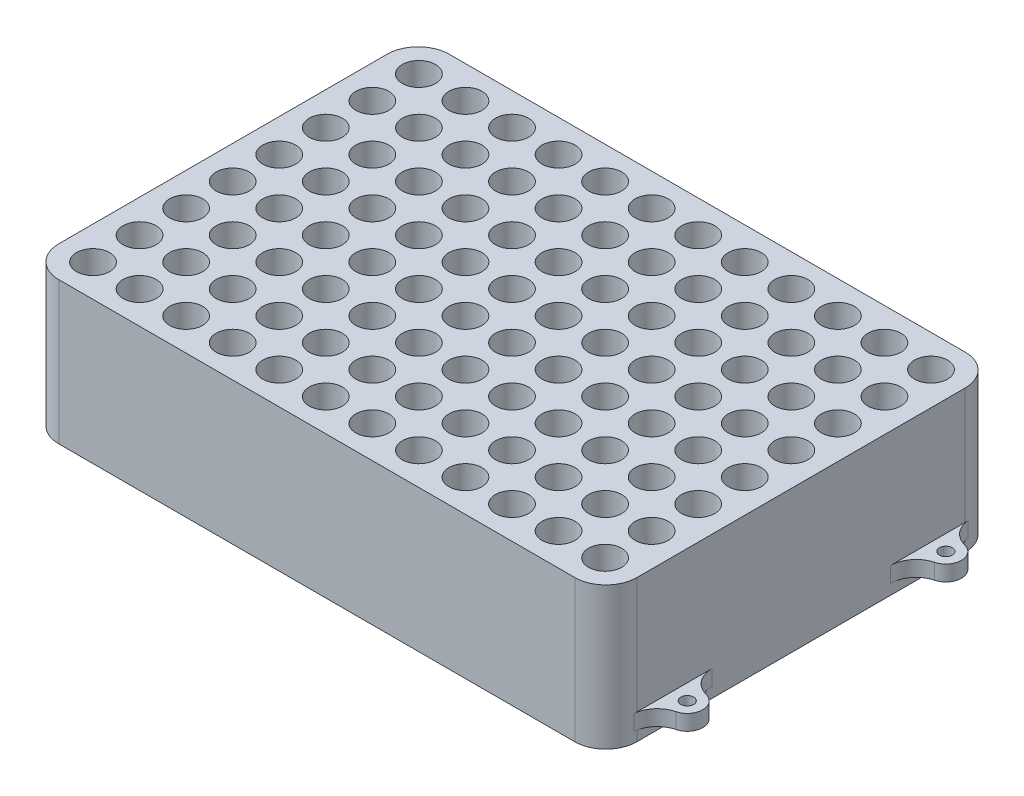
from build123d import *

# Parameters (mm, degrees)
BASE_STOCK_DEPTH        = 27.5
ESQUISSE2_R             = 3.2
VIALS_HOLES_DEPTH       = 80.026147572
ESQUISSE3_W             = 152.227357057
ESQUISSE3_H             = 97.588374714
ENL_V_MAT_EXTRU_2_DEPTH = 80.026147572
ENL_V_MAT_EXTRU_3_DEPTH = 20
BOSS_EXTRU_2_START      = 2
BOSS_EXTRU_2_DEPTH      = 3
CONG_1_R                = 5
TROU_TARAUD_M31_D       = 2.5


with BuildPart() as part:
    # Esquisse1 → Base Stock (new body)
    with BuildSketch(Plane(origin=(0, 0, 0), x_dir=(1, 0, 0), z_dir=(0, 1, 0))):
        with BuildLine():
            Line((-55.88, 40.74), (55.88, 40.74))
            ThreePointArc((55.88, 40.74), (60.122640687, 38.982640687), (61.88, 34.74))
            Line((61.88, 34.74), (61.88, -34.74))
            ThreePointArc((61.88, -34.74), (60.122640687, -38.982640687), (55.88, -40.74))
            Line((55.88, -40.74), (-55.88, -40.74))
            ThreePointArc((-55.88, -40.74), (-60.122640687, -38.982640687), (-61.88, -34.74))
            Line((-61.88, -34.74), (-61.88, 34.74))
            ThreePointArc((-61.88, 34.74), (-60.122640687, 38.982640687), (-55.88, 40.74))
        make_face()
    extrude(amount=BASE_STOCK_DEPTH)

    # Esquisse2 → Vials holes (cut, through all)
    with BuildSketch(Plane(origin=(0, 27.5, 0), x_dir=(1, 0, 0), z_dir=(0, 1, 0))):
        with Locations(Location((-49.5, 31.5, 0), (0, 0, 270))):
            Circle(ESQUISSE2_R)
        with Locations(Location((-40.5, 31.5, 0), (0, 0, 270))):
            Circle(ESQUISSE2_R)
        with Locations(Location((-31.5, 31.5, 0), (0, 0, 270))):
            Circle(ESQUISSE2_R)
        with Locations(Location((-22.5, 31.5, 0), (0, 0, 270))):
            Circle(ESQUISSE2_R)
        with Locations(Location((-13.5, 31.5, 0), (0, 0, 270))):
            Circle(ESQUISSE2_R)
        with Locations(Location((-4.5, 31.5, 0), (0, 0, 270))):
            Circle(ESQUISSE2_R)
        with Locations(Location((4.5, 31.5, 0), (0, 0, 270))):
            Circle(ESQUISSE2_R)
        with Locations(Location((13.5, 31.5, 0), (0, 0, 270))):
            Circle(ESQUISSE2_R)
        with Locations(Location((22.5, 31.5, 0), (0, 0, 270))):
            Circle(ESQUISSE2_R)
        with Locations(Location((31.5, 31.5, 0), (0, 0, 270))):
            Circle(ESQUISSE2_R)
        with Locations(Location((40.5, 31.5, 0), (0, 0, 270))):
            Circle(ESQUISSE2_R)
        with Locations(Location((49.5, 31.5, 0), (0, 0, 270))):
            Circle(ESQUISSE2_R)
        with Locations(Location((-40.5, 22.5, 0), (0, 0, 270))):
            Circle(ESQUISSE2_R)
        with Locations(Location((-31.5, 22.5, 0), (0, 0, 270))):
            Circle(ESQUISSE2_R)
        with Locations(Location((-22.5, 22.5, 0), (0, 0, 270))):
            Circle(ESQUISSE2_R)
        with Locations(Location((-13.5, 22.5, 0), (0, 0, 270))):
            Circle(ESQUISSE2_R)
        with Locations(Location((-4.5, 22.5, 0), (0, 0, 270))):
            Circle(ESQUISSE2_R)
        with Locations(Location((4.5, 22.5, 0), (0, 0, 270))):
            Circle(ESQUISSE2_R)
        with Locations(Location((13.5, 22.5, 0), (0, 0, 270))):
            Circle(ESQUISSE2_R)
        with Locations(Location((22.5, 22.5, 0), (0, 0, 270))):
            Circle(ESQUISSE2_R)
        with Locations(Location((31.5, 22.5, 0), (0, 0, 270))):
            Circle(ESQUISSE2_R)
        with Locations(Location((40.5, 22.5, 0), (0, 0, 270))):
            Circle(ESQUISSE2_R)
        with Locations(Location((49.5, 22.5, 0), (0, 0, 270))):
            Circle(ESQUISSE2_R)
        with Locations(Location((-40.5, 13.5, 0), (0, 0, 270))):
            Circle(ESQUISSE2_R)
        with Locations(Location((-31.5, 13.5, 0), (0, 0, 270))):
            Circle(ESQUISSE2_R)
        with Locations(Location((-22.5, 13.5, 0), (0, 0, 270))):
            Circle(ESQUISSE2_R)
        with Locations(Location((-13.5, 13.5, 0), (0, 0, 270))):
            Circle(ESQUISSE2_R)
        with Locations(Location((-4.5, 13.5, 0), (0, 0, 270))):
            Circle(ESQUISSE2_R)
        with Locations(Location((4.5, 13.5, 0), (0, 0, 270))):
            Circle(ESQUISSE2_R)
        with Locations(Location((13.5, 13.5, 0), (0, 0, 270))):
            Circle(ESQUISSE2_R)
        with Locations(Location((22.5, 13.5, 0), (0, 0, 270))):
            Circle(ESQUISSE2_R)
        with Locations(Location((31.5, 13.5, 0), (0, 0, 270))):
            Circle(ESQUISSE2_R)
        with Locations(Location((40.5, 13.5, 0), (0, 0, 270))):
            Circle(ESQUISSE2_R)
        with Locations(Location((49.5, 13.5, 0), (0, 0, 270))):
            Circle(ESQUISSE2_R)
        with Locations(Location((-40.5, 4.5, 0), (0, 0, 270))):
            Circle(ESQUISSE2_R)
        with Locations(Location((-31.5, 4.5, 0), (0, 0, 270))):
            Circle(ESQUISSE2_R)
        with Locations(Location((-22.5, 4.5, 0), (0, 0, 270))):
            Circle(ESQUISSE2_R)
        with Locations(Location((-13.5, 4.5, 0), (0, 0, 270))):
            Circle(ESQUISSE2_R)
        with Locations(Location((-4.5, 4.5, 0), (0, 0, 270))):
            Circle(ESQUISSE2_R)
        with Locations(Location((4.5, 4.5, 0), (0, 0, 270))):
            Circle(ESQUISSE2_R)
        with Locations(Location((13.5, 4.5, 0), (0, 0, 270))):
            Circle(ESQUISSE2_R)
        with Locations(Location((22.5, 4.5, 0), (0, 0, 270))):
            Circle(ESQUISSE2_R)
        with Locations(Location((31.5, 4.5, 0), (0, 0, 270))):
            Circle(ESQUISSE2_R)
        with Locations(Location((40.5, 4.5, 0), (0, 0, 270))):
            Circle(ESQUISSE2_R)
        with Locations(Location((49.5, 4.5, 0), (0, 0, 270))):
            Circle(ESQUISSE2_R)
        with Locations(Location((-40.5, -4.5, 0), (0, 0, 270))):
            Circle(ESQUISSE2_R)
        with Locations(Location((-31.5, -4.5, 0), (0, 0, 270))):
            Circle(ESQUISSE2_R)
        with Locations(Location((-22.5, -4.5, 0), (0, 0, 270))):
            Circle(ESQUISSE2_R)
        with Locations(Location((-13.5, -4.5, 0), (0, 0, 270))):
            Circle(ESQUISSE2_R)
        with Locations(Location((-4.5, -4.5, 0), (0, 0, 270))):
            Circle(ESQUISSE2_R)
        with Locations(Location((4.5, -4.5, 0), (0, 0, 270))):
            Circle(ESQUISSE2_R)
        with Locations(Location((13.5, -4.5, 0), (0, 0, 270))):
            Circle(ESQUISSE2_R)
        with Locations(Location((22.5, -4.5, 0), (0, 0, 270))):
            Circle(ESQUISSE2_R)
        with Locations(Location((31.5, -4.5, 0), (0, 0, 270))):
            Circle(ESQUISSE2_R)
        with Locations(Location((40.5, -4.5, 0), (0, 0, 270))):
            Circle(ESQUISSE2_R)
        with Locations(Location((49.5, -4.5, 0), (0, 0, 270))):
            Circle(ESQUISSE2_R)
        with Locations(Location((-40.5, -13.5, 0), (0, 0, 270))):
            Circle(ESQUISSE2_R)
        with Locations(Location((-31.5, -13.5, 0), (0, 0, 270))):
            Circle(ESQUISSE2_R)
        with Locations(Location((-22.5, -13.5, 0), (0, 0, 270))):
            Circle(ESQUISSE2_R)
        with Locations(Location((-13.5, -13.5, 0), (0, 0, 270))):
            Circle(ESQUISSE2_R)
        with Locations(Location((-4.5, -13.5, 0), (0, 0, 270))):
            Circle(ESQUISSE2_R)
        with Locations(Location((4.5, -13.5, 0), (0, 0, 270))):
            Circle(ESQUISSE2_R)
        with Locations(Location((13.5, -13.5, 0), (0, 0, 270))):
            Circle(ESQUISSE2_R)
        with Locations(Location((22.5, -13.5, 0), (0, 0, 270))):
            Circle(ESQUISSE2_R)
        with Locations(Location((31.5, -13.5, 0), (0, 0, 270))):
            Circle(ESQUISSE2_R)
        with Locations(Location((40.5, -13.5, 0), (0, 0, 270))):
            Circle(ESQUISSE2_R)
        with Locations(Location((49.5, -13.5, 0), (0, 0, 270))):
            Circle(ESQUISSE2_R)
        with Locations(Location((-40.5, -22.5, 0), (0, 0, 270))):
            Circle(ESQUISSE2_R)
        with Locations(Location((-31.5, -22.5, 0), (0, 0, 270))):
            Circle(ESQUISSE2_R)
        with Locations(Location((-22.5, -22.5, 0), (0, 0, 270))):
            Circle(ESQUISSE2_R)
        with Locations(Location((-13.5, -22.5, 0), (0, 0, 270))):
            Circle(ESQUISSE2_R)
        with Locations(Location((-4.5, -22.5, 0), (0, 0, 270))):
            Circle(ESQUISSE2_R)
        with Locations(Location((4.5, -22.5, 0), (0, 0, 270))):
            Circle(ESQUISSE2_R)
        with Locations(Location((13.5, -22.5, 0), (0, 0, 270))):
            Circle(ESQUISSE2_R)
        with Locations(Location((22.5, -22.5, 0), (0, 0, 270))):
            Circle(ESQUISSE2_R)
        with Locations(Location((31.5, -22.5, 0), (0, 0, 270))):
            Circle(ESQUISSE2_R)
        with Locations(Location((40.5, -22.5, 0), (0, 0, 270))):
            Circle(ESQUISSE2_R)
        with Locations(Location((49.5, -22.5, 0), (0, 0, 270))):
            Circle(ESQUISSE2_R)
        with Locations(Location((-40.5, -31.5, 0), (0, 0, 270))):
            Circle(ESQUISSE2_R)
        with Locations(Location((-31.5, -31.5, 0), (0, 0, 270))):
            Circle(ESQUISSE2_R)
        with Locations(Location((-22.5, -31.5, 0), (0, 0, 270))):
            Circle(ESQUISSE2_R)
        with Locations(Location((-13.5, -31.5, 0), (0, 0, 270))):
            Circle(ESQUISSE2_R)
        with Locations(Location((-4.5, -31.5, 0), (0, 0, 270))):
            Circle(ESQUISSE2_R)
        with Locations(Location((4.5, -31.5, 0), (0, 0, 270))):
            Circle(ESQUISSE2_R)
        with Locations(Location((13.5, -31.5, 0), (0, 0, 270))):
            Circle(ESQUISSE2_R)
        with Locations(Location((22.5, -31.5, 0), (0, 0, 270))):
            Circle(ESQUISSE2_R)
        with Locations(Location((31.5, -31.5, 0), (0, 0, 270))):
            Circle(ESQUISSE2_R)
        with Locations(Location((40.5, -31.5, 0), (0, 0, 270))):
            Circle(ESQUISSE2_R)
        with Locations(Location((49.5, -31.5, 0), (0, 0, 270))):
            Circle(ESQUISSE2_R)
        with Locations(Location((-49.5, 22.5, 0), (0, 0, 270))):
            Circle(ESQUISSE2_R)
        with Locations(Location((-49.5, 13.5, 0), (0, 0, 270))):
            Circle(ESQUISSE2_R)
        with Locations(Location((-49.5, 4.5, 0), (0, 0, 270))):
            Circle(ESQUISSE2_R)
        with Locations(Location((-49.5, -4.5, 0), (0, 0, 270))):
            Circle(ESQUISSE2_R)
        with Locations(Location((-49.5, -13.5, 0), (0, 0, 270))):
            Circle(ESQUISSE2_R)
        with Locations(Location((-49.5, -22.5, 0), (0, 0, 270))):
            Circle(ESQUISSE2_R)
        with Locations(Location((-49.5, -31.5, 0), (0, 0, 270))):
            Circle(ESQUISSE2_R)
    extrude(amount=-VIALS_HOLES_DEPTH, mode=Mode.SUBTRACT)

    # Esquisse3 → Enlèv. mat.-Extru.2 (cut, through all)
    with BuildSketch(Plane(origin=(0, 27.5, 0), x_dir=(1, 0, 0), z_dir=(0, 1, 0))):
        with Locations((-4.567532532, 0.853734099)):
            Rectangle(ESQUISSE3_W, ESQUISSE3_H)
        with BuildLine():
            Line((-49.88, 37.74), (49.88, 37.74))
            ThreePointArc((49.88, 37.74), (54.122640687, 35.982640687), (55.88, 31.74))
            Line((55.88, 31.74), (55.88, -31.74))
            ThreePointArc((55.88, -31.74), (54.122640687, -35.982640687), (49.88, -37.74))
            Line((49.88, -37.74), (-49.88, -37.74))
            ThreePointArc((-49.88, -37.74), (-54.122640687, -35.982640687), (-55.88, -31.74))
            Line((-55.88, -31.74), (-55.88, 31.74))
            ThreePointArc((-55.88, 31.74), (-54.122640687, 35.982640687), (-49.88, 37.74))
        make_face(mode=Mode.SUBTRACT)
    extrude(amount=-ENL_V_MAT_EXTRU_2_DEPTH, mode=Mode.SUBTRACT)

    # Esquisse4 → Enlèv. mat.-Extru.3 (cut)
    with BuildSketch(Plane.XZ):
        with BuildLine():
            Line((49.45, -34.9), (-49.45, -34.9))
            ThreePointArc((-49.45, -34.9), (-51.889518395, -33.889518395), (-52.9, -31.45))
            Line((-52.9, -31.45), (-52.9, 31.45))
            ThreePointArc((-52.9, 31.45), (-51.889518395, 33.889518395), (-49.45, 34.9))
            Line((-49.45, 34.9), (49.45, 34.9))
            ThreePointArc((49.45, 34.9), (51.889518395, 33.889518395), (52.9, 31.45))
            Line((52.9, 31.45), (52.9, -31.45))
            ThreePointArc((52.9, -31.45), (51.889518395, -33.889518395), (49.45, -34.9))
        make_face()
    extrude(amount=-ENL_V_MAT_EXTRU_3_DEPTH, mode=Mode.SUBTRACT)

    # Esquisse5 → Boss.-Extru.2 (add)
    with BuildSketch(Plane(origin=(0, 0, 0), x_dir=(1, 0, 0), z_dir=(0, 1, 0)).offset(BOSS_EXTRU_2_START)):
        with BuildLine():
            Line((58.88, -28), (55.88, -28))
            Line((55.88, -28), (55.88, -22))
            Line((55.88, -22), (58.88, -22))
            ThreePointArc((58.88, -22), (61.88, -25), (58.88, -28))
        make_face()
        with BuildLine():
            Line((-58.88, -28), (-55.88, -28))
            Line((-55.88, -28), (-55.88, -22))
            Line((-55.88, -22), (-58.88, -22))
            ThreePointArc((-58.88, -22), (-61.88, -25), (-58.88, -28))
        make_face()
        with BuildLine():
            Line((-58.88, 22), (-55.88, 22))
            Line((-55.88, 22), (-55.88, 28))
            Line((-55.88, 28), (-58.88, 28))
            ThreePointArc((-58.88, 28), (-61.88, 25), (-58.88, 22))
        make_face()
        with BuildLine():
            Line((58.88, 28), (55.88, 28))
            Line((55.88, 28), (55.88, 22))
            Line((55.88, 22), (58.88, 22))
            ThreePointArc((58.88, 22), (61.88, 25), (58.88, 28))
        make_face()
    extrude(amount=BOSS_EXTRU_2_DEPTH)

    # Congé1
    # the kernel refuses this fillet: 5 mm, written as the material it adds along each edge
    with BuildSketch(Plane(origin=(55.88, 2, -22), x_dir=(0, 0, 1), z_dir=(0, 1, 0)), Plane(origin=(-55.88, 2, 22), x_dir=(0, 0, -1), z_dir=(0, 1, 0))) as cong_1_piece_1:
        with BuildLine():
            CenterArc((4.745966692, 5), CONG_1_R, 194.477512186, 75.522487814)
            Line((-0.09526249, 3.75), (-0.579385409, 3.625))
            ThreePointArc((-0.579385409, 3.625), (-0.5, 3), (-0.5, 0))
            Line((-0.5, 0), (0, -0.5))
            Line((0, -0.5), (4.745966692, -0.5))
            Line((4.745966692, -0.5), (4.745966692, 0))
        make_face()
    extrude(amount=3)
    with BuildSketch(Plane(origin=(55.88, 2, 28), x_dir=(-0.005994702695277387, 0, 0.9999820316083662), z_dir=(0, 1, 0)), Plane(origin=(-55.88, 2, -28), x_dir=(0.0059947026952757426, 0, -0.9999820316083662), z_dir=(0, 1, 0))) as cong_1_piece_2:
        with BuildLine():
            CenterArc((4.728226311, 4.981226668), CONG_1_R, 194.472073207, 70.561325603)
            Line((-0.11312151, 3.731686242), (-0.597256292, 3.6067322))
            ThreePointArc((-0.597256292, 3.6067322), (-0.517975124, 2.996948743), (-0.499991016, -0.002997351))
            Line((-0.499991016, -0.002997351), (0.002997351, -0.499991016))
            ThreePointArc((0.002997351, -0.499991016), (3.74293015, -0.477570828), (4.252063663, -0.498122667))
            Line((4.252063663, -0.498122667), (4.295351176, 0))
        make_face()
    extrude(amount=3)
    with BuildSketch(Plane(origin=(-55.88, 2, 28), x_dir=(0.005994702695275762, 0, 0.999982031608366), z_dir=(0, 1, 0)), Plane(origin=(55.88, 2, -28), x_dir=(-0.005994702695279051, 0, -0.9999820316083662), z_dir=(0, 1, 0))) as cong_1_piece_3:
        with BuildLine():
            CenterArc((4.728226311, -4.981226668), CONG_1_R, 94.966601189, 70.561325603)
            Line((-0.11312151, -3.731686242), (-0.597256292, -3.6067322))
            ThreePointArc((-0.597256292, -3.6067322), (-0.517975124, -2.996948743), (-0.499991016, 0.002997351))
            Line((-0.499991016, 0.002997351), (0.002997351, 0.499991016))
            ThreePointArc((0.002997351, 0.499991016), (3.74293015, 0.477570828), (4.252063663, 0.498122667))
            Line((4.252063663, 0.498122667), (4.295351176, 0))
        make_face()
    extrude(amount=3)
    with BuildSketch(Plane(origin=(-55.88, 2, -22), x_dir=(0, 0, 1), z_dir=(0, 1, 0)), Plane(origin=(55.88, 2, 22), x_dir=(0, 0, -1), z_dir=(0, 1, 0))) as cong_1_piece_4:
        with BuildLine():
            CenterArc((4.745966692, -5), CONG_1_R, 90, 75.522487814)
            Line((-0.09526249, -3.75), (-0.579385409, -3.625))
            ThreePointArc((-0.579385409, -3.625), (-0.5, -3), (-0.5, 0))
            Line((-0.5, 0), (0, 0.5))
            Line((0, 0.5), (4.745966692, 0.5))
            Line((4.745966692, 0.5), (4.745966692, 0))
        make_face()
    extrude(amount=3)

    # Trou taraudé M31 (through all)
    with Locations(Plane(origin=(0, 5, 0), x_dir=(1, 0, 0), z_dir=(0, 1, 0))):
        with Locations((-58.88, 25), (-58.88, -25), (58.88, 25), (58.88, -25)):
            Hole(TROU_TARAUD_M31_D / 2)


solid = part.part
